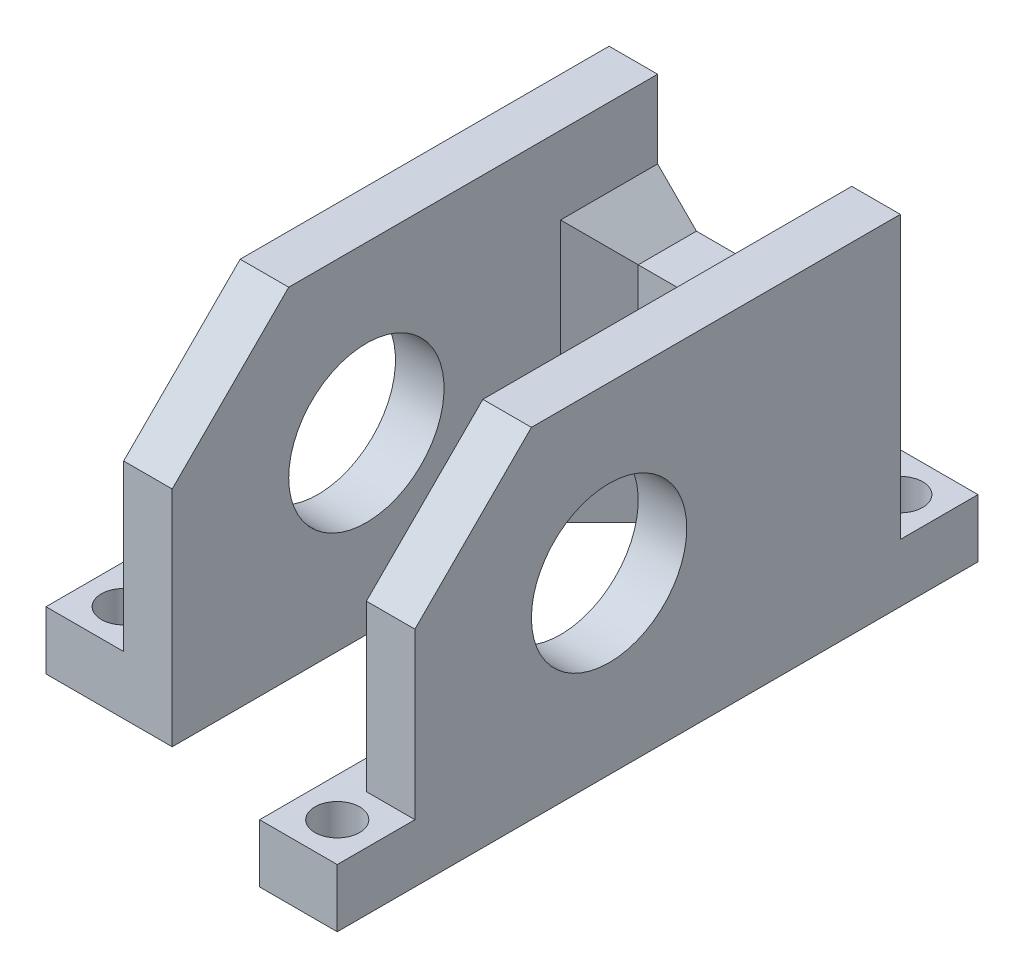
from build123d import *

# Parameters (mm, degrees)
BOSS_EXTRU_1_DEPTH      = 35
BOSS_EXTRU_7_DEPTH      = 8
ESQUISSE1_8_W           = 8
ESQUISSE1_8_H           = 8
ESQUISSE1_8_R           = 2.3
BOSS_EXTRU_8_DEPTH      = 6
BOSS_EXTRU_9_DEPTH      = 35
ENL_V_MAT_EXTRU_5_DEPTH = 35
ESQUISSE8_R             = 8
ENL_V_MAT_EXTRU_6_DEPTH = 50


with BuildPart() as part:
    # Esquisse1 → Boss.-Extru.1 (new body)
    with BuildSketch(Plane(origin=(0, 0, 0), x_dir=(1, 0, 0), z_dir=(0, 1, 0))):
        Polygon((-18, 9), (-23, 9), (-23, 3), (-23, 1), (-23, -33), (-23, -41), (-18, -41), (-18, 3), (2, 3), (2, -37), (2, -41), (7, -41), (7, 3), (7, 9), (2, 9), (-1, 9), align=None)
    extrude(amount=BOSS_EXTRU_1_DEPTH)

    # Esquisse1<6> → Boss.-Extru.7 (add)
    with BuildSketch(Plane(origin=(0, 0, 0), x_dir=(1, 0, 0), z_dir=(0, 1, 0))):
        Polygon((-18, 9), (-23, 9), (-23, 3), (-23, 1), (-23, -33), (-23, -41), (-18, -41), (-18, 3), (2, 3), (2, -37), (2, -41), (7, -41), (7, 3), (7, 9), (2, 9), (-1, 9), align=None)
    extrude(amount=BOSS_EXTRU_7_DEPTH)

    # Esquisse1<8> → Boss.-Extru.8 (add)
    # profile 1 of 4: a face of its own
    with BuildSketch(Plane(origin=(0, 0, 0), x_dir=(1, 0, 0), z_dir=(0, 1, 0))):
        with Locations((-27, 5)):
            Rectangle(ESQUISSE1_8_W, ESQUISSE1_8_H)
        with Locations((-27, 5)):
            Circle(ESQUISSE1_8_R, mode=Mode.SUBTRACT)
    # profile 2 of 4: a face of its own
    with BuildSketch(Plane(origin=(0, 0, 0), x_dir=(1, 0, 0), z_dir=(0, 1, 0))):
        with Locations((3, 13)):
            Rectangle(ESQUISSE1_8_W, ESQUISSE1_8_H)
        with Locations((3, 13)):
            Circle(ESQUISSE1_8_R, mode=Mode.SUBTRACT)
    # profile 3 of 4: a face of its own
    with BuildSketch(Plane(origin=(0, 0, 0), x_dir=(1, 0, 0), z_dir=(0, 1, 0))):
        with Locations((-27, -37)):
            Rectangle(ESQUISSE1_8_W, ESQUISSE1_8_H)
        with Locations((-27, -37)):
            Circle(ESQUISSE1_8_R, mode=Mode.SUBTRACT)
    # profile 4 of 4: a face of its own
    with BuildSketch(Plane(origin=(0, 0, 0), x_dir=(1, 0, 0), z_dir=(0, 1, 0))):
        Polygon((7, -49), (7, -41), (2, -41), (2, -37), (-1, -37), (-1, -49), align=None)
        with Locations((3, -45)):
            Circle(ESQUISSE1_8_R, mode=Mode.SUBTRACT)
    extrude(amount=BOSS_EXTRU_8_DEPTH)

    # Esquisse6 → Boss.-Extru.9 (add)
    with BuildSketch(Plane.XZ):
        Polygon((-18, -3), (-14, -3), (-18, 1), align=None)
        Polygon((2, -3), (-2, -3), (2, 1), align=None)
    extrude(amount=-BOSS_EXTRU_9_DEPTH)

    # Esquisse7 → Enlèv. mat.-Extru.5 (cut)
    with BuildSketch(Plane(origin=(0, 0, -9), x_dir=(-1, 0, 0), z_dir=(0, 0, -1))):
        Polygon((18, 35), (-2, 35), (-2, 27), (2, 23), (14, 23), (18, 27), align=None)
    extrude(amount=-ENL_V_MAT_EXTRU_5_DEPTH, mode=Mode.SUBTRACT)

    # Esquisse8 → Enlèv. mat.-Extru.6 (cut)
    with BuildSketch(Plane.ZY.offset(23)):
        Polygon((41, 23), (41, 35), (29, 35), align=None)
        with Locations((21, 18)):
            Circle(ESQUISSE8_R)
    extrude(amount=-ENL_V_MAT_EXTRU_6_DEPTH, mode=Mode.SUBTRACT)


solid = part.part
